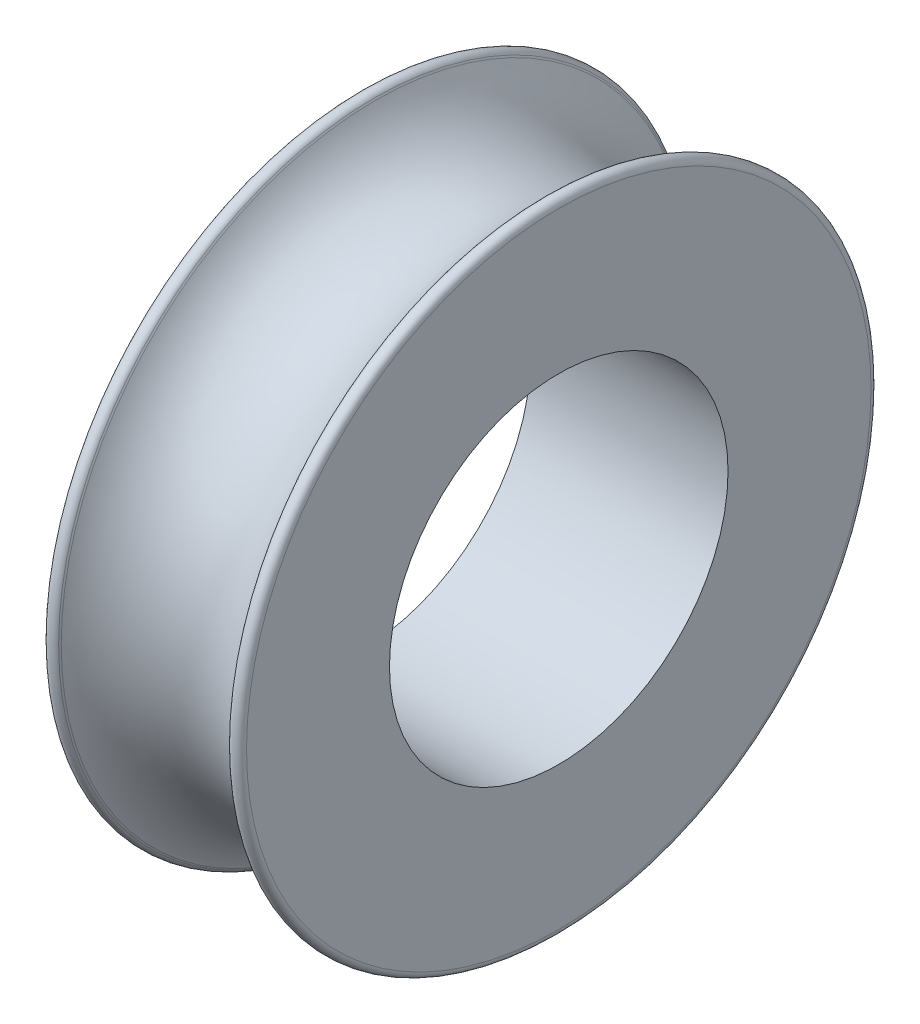
from build123d import *

# Parameters (mm, degrees)
FILLET1_R          = 0.25
CUT_EXTRUDE1_REACH = 19.468
SKETCH3_R          = 6


with BuildPart() as part:
    # Sketch2 → Revolve1 (revolve)
    with BuildSketch(Plane.XY):
        with BuildLine():
            Line((0, 0), (7, 0))
            Line((7, 0), (7, 12))
            Line((7, 12), (6.500012286, 11.133995876))
            ThreePointArc((6.500012286, 11.133995876), (3.5, 9.28506529), (0.499987714, 11.133995876))
            Line((0.499987714, 11.133995876), (0, 12))
            Line((0, 12), (0, 0))
        make_face()
    revolve(axis=Axis((0, 0, 0), (1, 0, 0)))

    # Fillet1
    fillet1_edges = [part.edges().sort_by_distance(p)[0] for p in [
        (7, -12, 0),
        (0, -12, 0),
    ]]
    fillet(fillet1_edges, radius=FILLET1_R)

    # Sketch3 → Cut-Extrude1 (cut, up to next)
    with BuildSketch(Plane.ZY, mode=Mode.PRIVATE) as cut_extrude1_sk1:
        Circle(SKETCH3_R)
    cut_extrude1_tool1 = extrude(cut_extrude1_sk1.sketch, amount=-CUT_EXTRUDE1_REACH, mode=Mode.PRIVATE) & part.part
    add(cut_extrude1_tool1.solids().sort_by_distance((0, 0, 0))[0], mode=Mode.SUBTRACT)


solid = part.part
